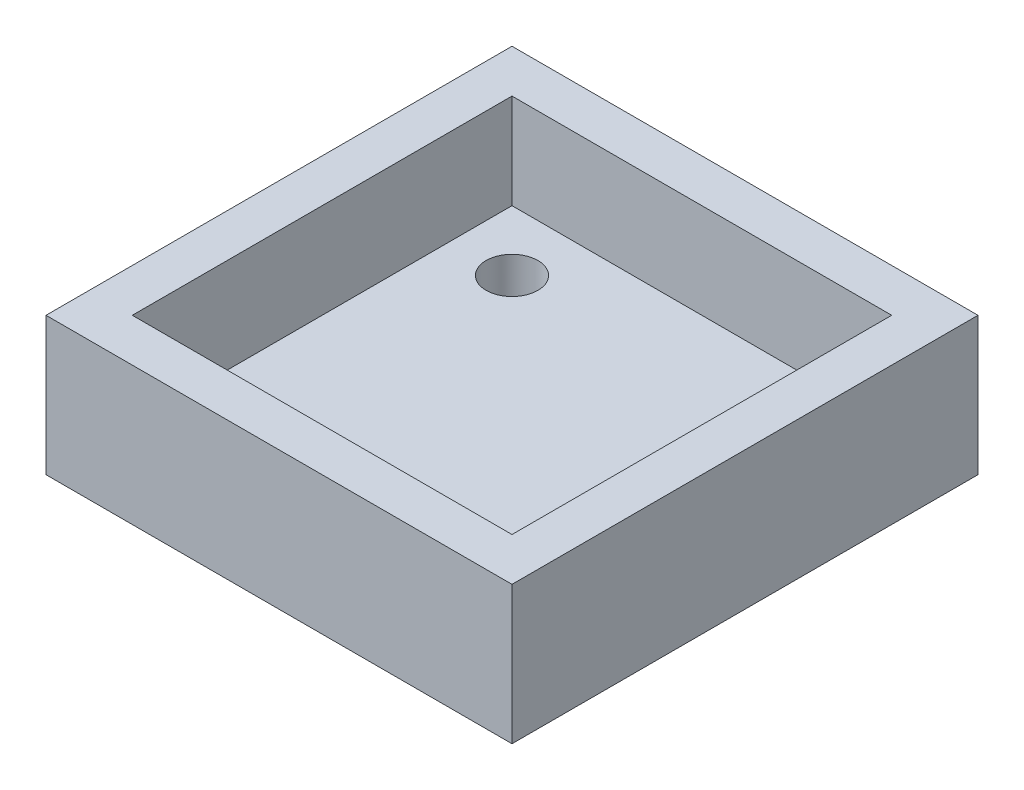
from build123d import *

# Parameters (mm, degrees)
SKETCH2_W           = 27
SKETCH2_H           = 27
BOSS_EXTRUDE1_DEPTH = 8
SKETCH5_W           = 22
SKETCH5_H           = 22
CUT_EXTRUDE2_DEPTH  = 5.5
SKETCH3_R           = 1.5
CUT_EXTRUDE3_DEPTH  = 10
CUT_EXTRUDE4_DEPTH  = 10


with BuildPart() as part:
    # Sketch2 → Boss-Extrude1 (new body)
    with BuildSketch(Plane(origin=(0, 0, 0), x_dir=(1, 0, 0), z_dir=(0, 1, 0))):
        with Locations((13.5, 13.5)):
            Rectangle(SKETCH2_W, SKETCH2_H)
    extrude(amount=BOSS_EXTRUDE1_DEPTH)

    # Sketch5 → Cut-Extrude2 (cut)
    with BuildSketch(Plane(origin=(0, 8, 0), x_dir=(1, 0, 0), z_dir=(0, 1, 0))):
        with Locations((13.5, 13.5)):
            Rectangle(SKETCH5_W, SKETCH5_H)
    extrude(amount=-CUT_EXTRUDE2_DEPTH, mode=Mode.SUBTRACT)

    # Sketch3 → Cut-Extrude3 (cut)
    with BuildSketch(Plane(origin=(0, 0, 0), x_dir=(-1, 0, 0), z_dir=(0, -1, 0))):
        with Locations((-6, 21)):
            Circle(SKETCH3_R)
        with Locations((-6, 5)):
            Circle(SKETCH3_R)
    extrude(amount=-CUT_EXTRUDE3_DEPTH, mode=Mode.SUBTRACT)

    # Sketch6 → Cut-Extrude4 (cut)
    with BuildSketch(Plane(origin=(0, 2.5, 0), x_dir=(1, 0, 0), z_dir=(0, 1, 0))):
        with BuildLine():
            ThreePointArc((20.66886117, 24.5), (19.809648408, 23.517747652), (19.5, 22.25))
            Line((19.5, 22.25), (19.5, 5.75))
            ThreePointArc((19.5, 5.75), (20.305456352, 3.805456352), (22.25, 3))
            ThreePointArc((22.25, 3), (23.865824645, 3.9734162), (24.5, 5.75))
            Line((24.5, 5.75), (24.5, 22.25))
            ThreePointArc((24.5, 22.25), (24.201731176, 23.508830895), (23.370344792, 24.5))
            Line((23.370344792, 24.5), (20.66886117, 24.5))
        make_face()
    extrude(amount=-CUT_EXTRUDE4_DEPTH, mode=Mode.SUBTRACT)


solid = part.part
